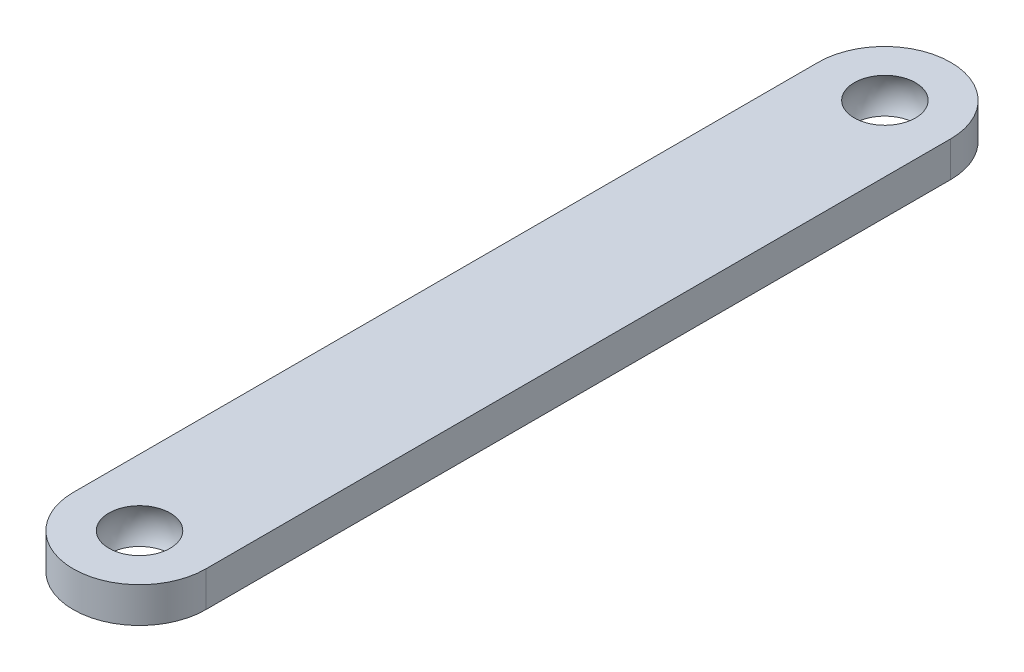
from build123d import *

# Parameters (mm, degrees)
SKETCH1_R           = 1.5875
BOSS_EXTRUDE1_DEPTH = 1.27


with BuildPart() as part:
    # Sketch1 → Boss-Extrude1 (new, symmetric)
    with BuildSketch(Plane(origin=(0, 0, 0), x_dir=(1, 0, 0), z_dir=(0, 1, 0))):
        with BuildLine():
            Line((4.7625, 53.5432), (4.7625, 0))
            ThreePointArc((4.7625, 0), (0, -4.7625), (-4.7625, 0))
            Line((-4.7625, 0), (-4.7625, 53.5432))
            ThreePointArc((-4.7625, 53.5432), (0, 58.3057), (4.7625, 53.5432))
        make_face()
        Circle(SKETCH1_R, mode=Mode.SUBTRACT)
        with Locations((0, 53.5432)):
            Circle(SKETCH1_R, mode=Mode.SUBTRACT)
    extrude(amount=BOSS_EXTRUDE1_DEPTH, both=True)

    # Sketch2 → Cut-Revolve1 (revolve, cut)
    with BuildSketch(Plane(origin=(0, 0, 0), x_dir=(0, 0, -1), z_dir=(1, 0, 0))):
        with BuildLine():
            Line((0, -2.54), (0, 2.54))
            ThreePointArc((0, 2.54), (2.54, 0), (0, -2.54))
        make_face()
    revolve(axis=Axis((0, -2.54, 0), (0, 1, 0)), mode=Mode.SUBTRACT)

    # Sketch3 → Cut-Revolve2 (revolve, cut)
    with BuildSketch(Plane(origin=(0, 0, 0), x_dir=(0, 0, -1), z_dir=(1, 0, 0))):
        with BuildLine():
            Line((53.574492193, -2.54), (53.574492193, 2.54))
            ThreePointArc((53.574492193, 2.54), (51.034492193, 0), (53.574492193, -2.54))
        make_face()
    revolve(axis=Axis((0, 8.508702539, -53.574492193), (0, -1, 0)), mode=Mode.SUBTRACT)


solid = part.part
